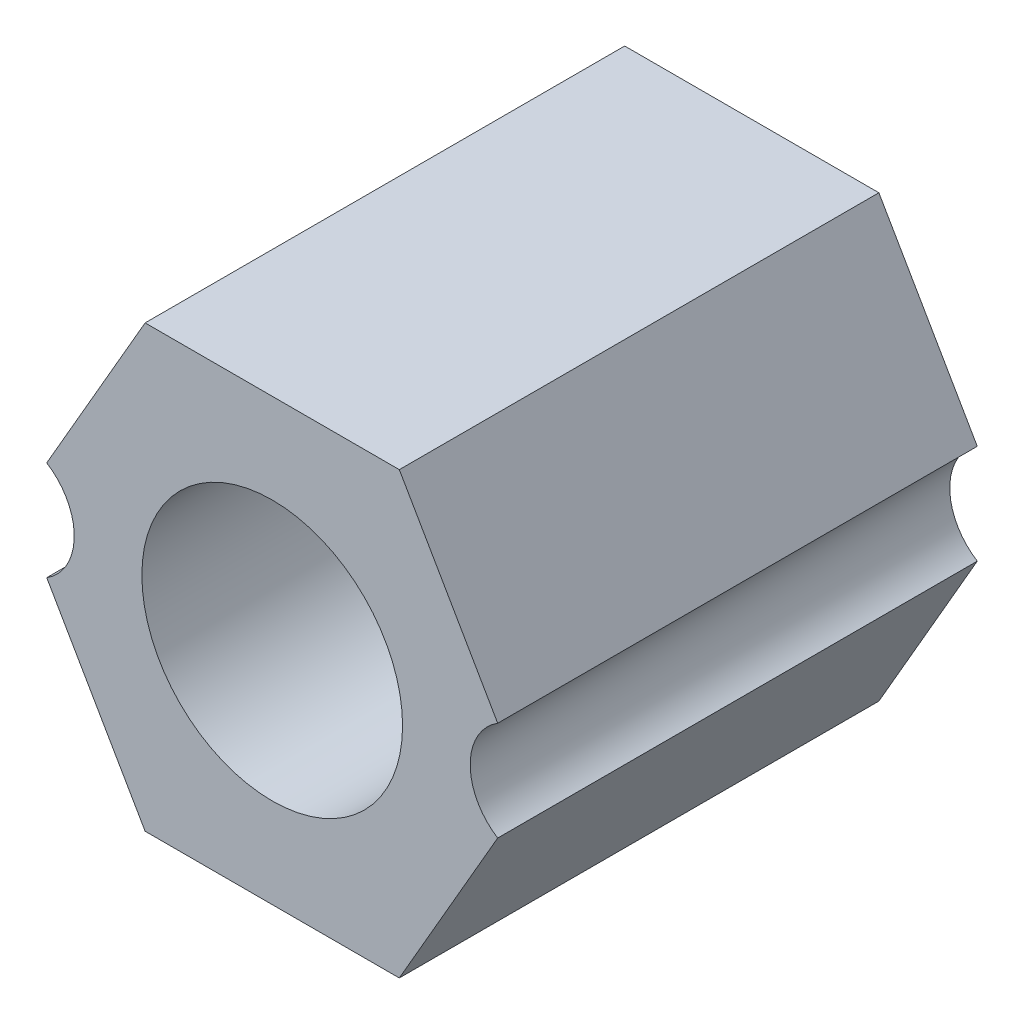
from build123d import *

# Parameters (mm, degrees)
SKETCH1_R               = 17
BOSS_EXTRUDE1_DEPTH     = 4.4
CAVITY1_OUTLINE_R       = 3.15
CAVITY1_DEPTH           = 3.283595969
CAVITY1_START           = 1.183595969
CAVITY1_2_OUTLINE_R     = 3.15
CAVITY1_2_OUTLINE_R_2   = 1.575
CAVITY1_2_DEPTH         = 2.1
SKETCH9_R               = 12.8
BOSS_EXTRUDE3_DEPTH     = 5.6
BOSS_EXTRUDE8_DEPTH     = 8
SKETCH2_R               = 0.6
CUT_EXTRUDE1_DEPTH      = 31.033314835
CIRPATTERN1_COUNT       = 6
CUT_EXTRUDE2_START      = -3.283596
SKETCH3_R               = 4.596048158
CUT_EXTRUDE2_DEPTH      = 3.283596
CUT_EXTRUDE3_DEPTH      = 31.033314835
CUT_EXTRUDE3_DEPTH_BACK = 4
SKETCH4_R               = 4
SKETCH6_R               = 1.8
CUT_EXTRUDE4_DEPTH      = 31.033314835
SKETCH12_4_OUTSIDE_W    = 46.268
SKETCH12_4_OUTSIDE_H    = 46.268
CUT_EXTRUDE5_DEPTH      = 27.038433133


# Read off the part's stored shape, not the designer's step: Cavity1
with BuildPart() as part:
    # Sketch1 → Boss-Extrude1 (new body)
    with BuildSketch(Plane.XY):
        Circle(SKETCH1_R)
    extrude(amount=BOSS_EXTRUDE1_DEPTH)

    # Cavity1 outline → Cavity1 (cut)
    with BuildSketch(Plane.XY):
        with BuildLine():
            Line((3.9375, 6.819950055), (2.048148228, 15.163776711))
            ThreePointArc((2.048148228, 15.163776711), (0, 16.8), (-2.048148228, 15.163776711))
            Line((-2.048148228, 15.163776711), (-3.9375, 6.819950055))
            Line((-3.9375, 6.819950055), (-12.108141735, 9.355636751))
            ThreePointArc((-12.108141735, 9.355636751), (-14.549226784, 8.4), (-14.156289963, 5.80813996))
            Line((-14.156289963, 5.80813996), (-7.875, 0))
            Line((-7.875, 0), (-14.156289963, -5.80813996))
            ThreePointArc((-14.156289963, -5.80813996), (-14.549226784, -8.4), (-12.108141735, -9.355636751))
            Line((-12.108141735, -9.355636751), (-3.9375, -6.819950055))
            Line((-3.9375, -6.819950055), (-2.048148228, -15.163776711))
            ThreePointArc((-2.048148228, -15.163776711), (0, -16.8), (2.048148228, -15.163776711))
            Line((2.048148228, -15.163776711), (3.9375, -6.819950055))
            Line((3.9375, -6.819950055), (12.108141735, -9.355636751))
            ThreePointArc((12.108141735, -9.355636751), (14.549226784, -8.4), (14.156289963, -5.80813996))
            Line((14.156289963, -5.80813996), (7.875, 0))
            Line((7.875, 0), (14.156289963, 5.80813996))
            ThreePointArc((14.156289963, 5.80813996), (14.549226784, 8.4), (12.108141735, 9.355636751))
            Line((12.108141735, 9.355636751), (3.9375, 6.819950055))
        make_face()
        Circle(CAVITY1_OUTLINE_R, mode=Mode.SUBTRACT)
    extrude(amount=CAVITY1_DEPTH, mode=Mode.SUBTRACT)

    # Cavity1 2 outline → Cavity1 2 (cut)
    with BuildSketch(Plane.XY.offset(CAVITY1_START)):
        Circle(CAVITY1_2_OUTLINE_R)
        Circle(CAVITY1_2_OUTLINE_R_2, mode=Mode.SUBTRACT)
    extrude(amount=CAVITY1_2_DEPTH, mode=Mode.SUBTRACT)

    # Sketch9 → Boss-Extrude3 (add)
    with BuildSketch(Plane.XY.offset(4.4)):
        Circle(SKETCH9_R)
    extrude(amount=BOSS_EXTRUDE3_DEPTH)

    # Sketch12 → Boss-Extrude8 (add)
    with BuildSketch(Plane.XY.offset(10)):
        Polygon((3.9, -6.75499815), (7.8, 0), (3.9, 6.75499815), (-3.9, 6.75499815), (-7.8, 0), (-3.9, -6.75499815), align=None)
    extrude(amount=BOSS_EXTRUDE8_DEPTH)

    # Sketch2 → Cut-Extrude1 (cut, through all)
    with BuildSketch(Plane(origin=(0, 0, 0), x_dir=(-1, 0, 0), z_dir=(0, 0, -1))):
        with Locations(Location((0, 13.5, 0), (0, 0, 180))):
            Circle(SKETCH2_R)
        with Locations(Location((0, 10.5, 0), (0, 0, 180))):
            Circle(SKETCH2_R)
        with Locations(Location((0, 7.5, 0), (0, 0, 180))):
            Circle(SKETCH2_R)
    cut_extrude1 = extrude(amount=-CUT_EXTRUDE1_DEPTH, mode=Mode.SUBTRACT)

    # CirPattern1: Cut-Extrude1 ×6 about axis
    cirpattern1_axis = Axis((0, 0, 0), (0, 0, 1))
    for i in range(1, CIRPATTERN1_COUNT):
        add(cut_extrude1.rotate(cirpattern1_axis, i * 360 / CIRPATTERN1_COUNT), mode=Mode.SUBTRACT)

    # Sketch3 → Cut-Extrude2 (cut)
    with BuildSketch(Plane(origin=(0, 0, 0), x_dir=(-1, 0, 0), z_dir=(0, 0, -1)).offset(CUT_EXTRUDE2_START)):
        Circle(SKETCH3_R)
    extrude(amount=CUT_EXTRUDE2_DEPTH, mode=Mode.SUBTRACT)

    # Sketch4 → Cut-Extrude3 (cut, two sides: drawn at the far end of the back side and taken through both)
    with BuildSketch(Plane.XY.offset(-CUT_EXTRUDE3_DEPTH_BACK)):
        Circle(SKETCH4_R)
    extrude(amount=CUT_EXTRUDE3_DEPTH + CUT_EXTRUDE3_DEPTH_BACK, mode=Mode.SUBTRACT)

    # Sketch6 → Cut-Extrude4 (cut, through all)
    with BuildSketch(Plane(origin=(0, 0, 0), x_dir=(-1, 0, 0), z_dir=(0, 0, -1))):
        with Locations(Location((-7.875, 0, 0), (0, 0, 302.067932294))):
            Circle(SKETCH6_R)
        with Locations(Location((7.875, 0, 0), (0, 0, 42.758730598))):
            Circle(SKETCH6_R)
    extrude(amount=-CUT_EXTRUDE4_DEPTH, mode=Mode.SUBTRACT)

    # Sketch12<4> outside → Cut-Extrude5 (cut, through all)
    with BuildSketch(Plane.XY.offset(10)):
        Rectangle(SKETCH12_4_OUTSIDE_W, SKETCH12_4_OUTSIDE_H)
        Polygon((3.9, -6.75499815), (7.8, 0), (3.9, 6.75499815), (-3.9, 6.75499815), (-7.8, 0), (-3.9, -6.75499815), align=None, mode=Mode.SUBTRACT)
    extrude(amount=-CUT_EXTRUDE5_DEPTH, mode=Mode.SUBTRACT)


solid = part.part
